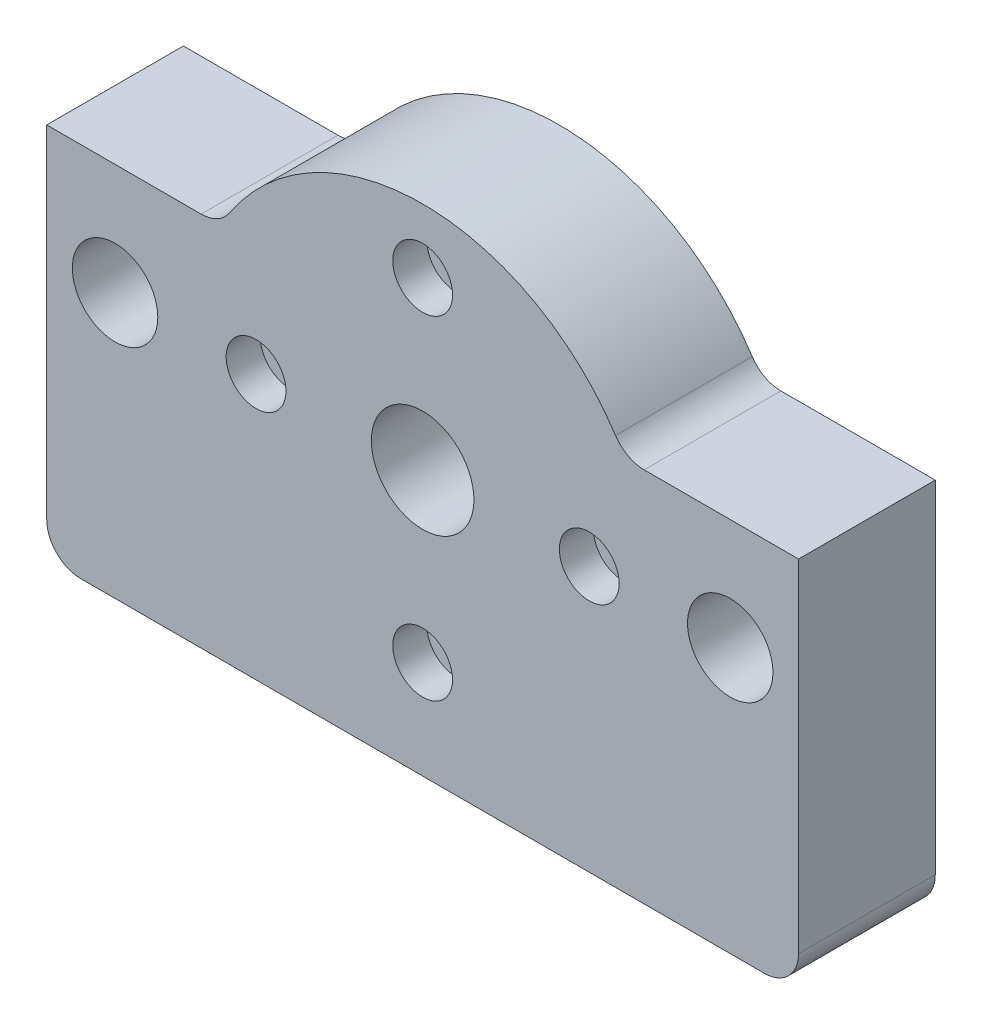
from build123d import *

# Parameters (mm, degrees)
BASE_DEPTH                     = 12.7
TUBE_COUNTERBORE_D             = 6.7564
TUBE_COUNTERBORE_CBORE_D       = 11.1125
TUBE_COUNTERBORE_CBORE_DEPTH   = 6.35
TUBE_COUNTERBORE_PATTERN_COUNT = 4
SKETCH8_R                      = 36.5125
STRUCTURE_TUBE_RECESS_DEPTH    = 7.62
SKETCH9_R                      = 9.525
LEAD_SCREW_THRU_HOLE_DEPTH     = 88.275546726
SKETCH13_R                     = 7.9375
RAIL_BORE_PILOT_HOLE_DEPTH     = 90.140634148
SKETCH14_R                     = 2.38125
ALIGNMENT_FEATURES_DEPTH       = 6.35
GENERIC_ROUNDING_FILLET_R      = 6.35


with BuildPart() as part:
    # Bolt circle → Base (new, symmetric)
    with BuildSketch(Plane.XY):
        with BuildLine():
            Line((37.567106623, 20.6375), (69.85, 20.6375))
            Line((69.85, 20.6375), (69.85, -49.2125))
            Line((69.85, -49.2125), (-69.85, -49.2125))
            Line((-69.85, -49.2125), (-69.85, 20.6375))
            Line((-69.85, 20.6375), (-37.567106623, 20.6375))
            ThreePointArc((-37.567106623, 20.6375), (0, 42.8625), (37.567106623, 20.6375))
        make_face()
    extrude(amount=BASE_DEPTH, both=True)

    # Tube counterbore (through all)
    with Locations(Plane.XY.offset(12.7)):
        with Locations((0, 30.95625)):
            tube_counterbore = CounterBoreHole(TUBE_COUNTERBORE_D / 2, TUBE_COUNTERBORE_CBORE_D / 2, TUBE_COUNTERBORE_CBORE_DEPTH)

    # Tube counterbore pattern: Tube counterbore ×4 about axis
    tube_counterbore_pattern_axis = Axis((0, 0, -80.9), (0, 0, 1))
    for i in range(1, TUBE_COUNTERBORE_PATTERN_COUNT):
        add(tube_counterbore.rotate(tube_counterbore_pattern_axis, i * 360 / TUBE_COUNTERBORE_PATTERN_COUNT), mode=Mode.SUBTRACT)

    # Sketch8 → Structure_tube_recess (cut)
    with BuildSketch(Plane(origin=(0, 0, -12.7), x_dir=(-1, 0, 0), z_dir=(0, 0, -1))):
        Circle(SKETCH8_R)
    extrude(amount=-STRUCTURE_TUBE_RECESS_DEPTH, mode=Mode.SUBTRACT)

    # Sketch9 → Lead_screw_thru_hole (cut, through all)
    with BuildSketch(Plane(origin=(0, 0, -5.08), x_dir=(-1, 0, 0), z_dir=(0, 0, -1))):
        Circle(SKETCH9_R)
    extrude(amount=-LEAD_SCREW_THRU_HOLE_DEPTH, mode=Mode.SUBTRACT)

    # Sketch13 → Rail_bore_pilot_hole (cut, through all)
    with BuildSketch(Plane.XY.offset(12.7)):
        with Locations((57.15, 0)):
            Circle(SKETCH13_R)
        with Locations((-57.15, 0)):
            Circle(SKETCH13_R)
    extrude(amount=-RAIL_BORE_PILOT_HOLE_DEPTH, mode=Mode.SUBTRACT)

    # Sketch14 → Alignment_features (cut)
    with BuildSketch(Plane(origin=(0, 0, -5.08), x_dir=(-1, 0, 0), z_dir=(0, 0, -1))):
        with Locations((-21.889374295, -21.889374295)):
            Circle(SKETCH14_R)
        with BuildLine():
            Line((20.681324246, 24.089602852), (19.602797121, 22.924727111))
            ThreePointArc((19.602797121, 22.924727111), (19.732320046, 19.559622813), (23.097424344, 19.689145738))
            Line((23.097424344, 19.689145738), (24.175951469, 20.854021479))
            ThreePointArc((24.175951469, 20.854021479), (24.046428544, 24.219125777), (20.681324246, 24.089602852))
        make_face()
    extrude(amount=-ALIGNMENT_FEATURES_DEPTH, mode=Mode.SUBTRACT)

    # Generic_rounding_fillet
    generic_rounding_fillet_edges = [part.edges().sort_by_distance(p)[0] for p in [
        (-69.85, -49.2125, 0),
        (69.85, -49.2125, 0),
        (37.567106623, 20.6375, 0),
        (-37.567106623, 20.6375, 0),
    ]]
    fillet(generic_rounding_fillet_edges, radius=GENERIC_ROUNDING_FILLET_R)


solid = part.part
